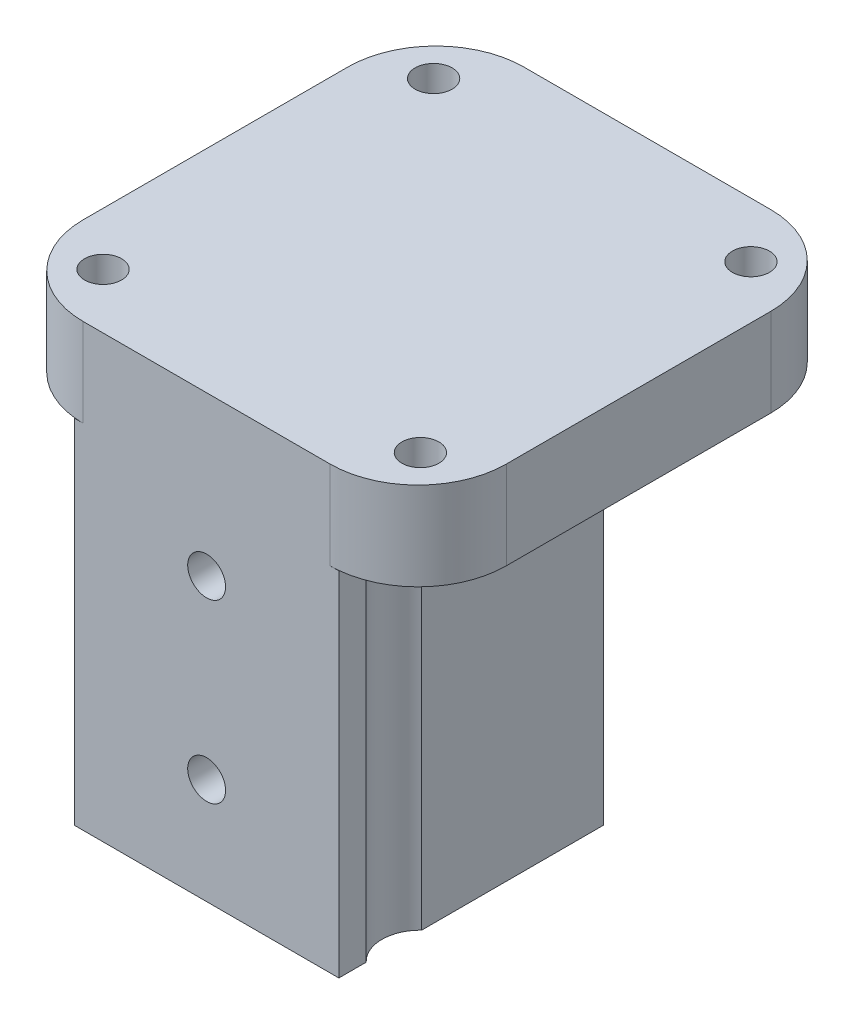
from build123d import *

# Parameters (mm, degrees)
SKETCH1_R           = 2.1
BOSS_EXTRUDE1_DEPTH = 10
SKETCH6_W           = 30
SKETCH6_H           = 30
SKETCH6_W_2         = 20
SKETCH6_H_2         = 20
BOSS_EXTRUDE5_DEPTH = 40
SKETCH7_R           = 4.35
CUT_EXTRUDE1_DEPTH  = 53.92447449
CUT_EXTRUDE2_REACH  = 70.381
SKETCH8_R           = 2.15
FILLET2_R           = 10


# Read off the part's stored shape, not the designer's step: moBlkMgr[demtay]
with BuildPart() as part:
    # Sketch1 → Boss-Extrude1 (new body)
    with BuildSketch(Plane(origin=(0, 0, 0), x_dir=(1, 0, 0), z_dir=(0, 1, 0))):
        with BuildLine():
            Line((-14, 25), (14, 25))
            ThreePointArc((14, 25), (21.071067812, 22.071067812), (24, 15))
            Line((24, 15), (24, -15))
            ThreePointArc((24, -15), (21.071067812, -22.071067812), (14, -25))
            Line((14, -25), (-14, -25))
            ThreePointArc((-14, -25), (-21.071067812, -22.071067812), (-24, -15))
            Line((-24, -15), (-24, 15))
            ThreePointArc((-24, 15), (-21.071067812, 22.071067812), (-14, 25))
        make_face()
        with Locations(Location((-18, 18.75, 0), (0, 0, 270))):
            Circle(SKETCH1_R, mode=Mode.SUBTRACT)
        with Locations(Location((18, 18.75, 0), (0, 0, 270))):
            Circle(SKETCH1_R, mode=Mode.SUBTRACT)
        with Locations(Location((18, -18.75, 0), (0, 0, 270))):
            Circle(SKETCH1_R, mode=Mode.SUBTRACT)
        with Locations(Location((-18, -18.75, 0), (0, 0, 270))):
            Circle(SKETCH1_R, mode=Mode.SUBTRACT)
    extrude(amount=BOSS_EXTRUDE1_DEPTH)

    # Sketch6 → Boss-Extrude5 (add)
    with BuildSketch(Plane(origin=(0, 0, 0), x_dir=(-1, 0, 0), z_dir=(0, -1, 0))):
        with Locations((0, -10)):
            Rectangle(SKETCH6_W, SKETCH6_H)
        with Locations((0, -10)):
            Rectangle(SKETCH6_W_2, SKETCH6_H_2, mode=Mode.SUBTRACT)
    extrude(amount=BOSS_EXTRUDE5_DEPTH)

    # Sketch7 → Cut-Extrude1 (cut, through all)
    with BuildSketch(Plane(origin=(0, 0, 0), x_dir=(-1, 0, 0), z_dir=(0, -1, 0))):
        with Locations((-18, -18.75)):
            Circle(SKETCH7_R)
        with Locations((18, -18.75)):
            Circle(SKETCH7_R)
    extrude(amount=CUT_EXTRUDE1_DEPTH, mode=Mode.SUBTRACT)

    # Sketch8 → Cut-Extrude2 (cut, up to next)
    with BuildSketch(Plane.XY.offset(25), mode=Mode.PRIVATE) as cut_extrude2_sk1:
        with Locations((0, -8)):
            Circle(SKETCH8_R)
    cut_extrude2_tool1 = extrude(cut_extrude2_sk1.sketch, amount=-CUT_EXTRUDE2_REACH, mode=Mode.PRIVATE) & part.part
    # Sketch8 → Cut-Extrude2 (cut, up to next)
    with BuildSketch(Plane.XY.offset(25), mode=Mode.PRIVATE) as cut_extrude2_sk2:
        with Locations((0, -28)):
            Circle(SKETCH8_R)
    cut_extrude2_tool2 = extrude(cut_extrude2_sk2.sketch, amount=-CUT_EXTRUDE2_REACH, mode=Mode.PRIVATE) & part.part
    add(cut_extrude2_tool1.solids().sort_by_distance((0, -8, 25))[0], mode=Mode.SUBTRACT)
    add(cut_extrude2_tool2.solids().sort_by_distance((0, -28, 25))[0], mode=Mode.SUBTRACT)

    # Fillet2
    fillet2_edges = [part.edges().sort_by_distance(p)[0] for p in [
        (0, 0, -5),
    ]]
    fillet(fillet2_edges, radius=FILLET2_R)


solid = part.part
